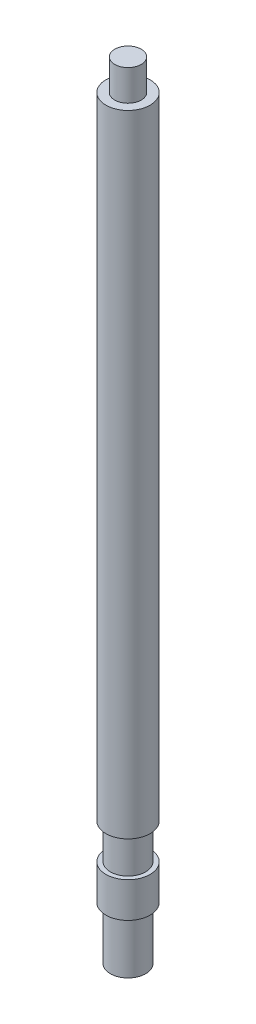
from build123d import *

# Parameters (mm, degrees)
SKETCH1_R           = 5
BOSS_EXTRUDE1_DEPTH = 143
SKETCH2_R           = 4
BOSS_EXTRUDE2_DEPTH = 8
BOSS_EXTRUDE3_START = 8
SKETCH3_R           = 5
BOSS_EXTRUDE3_DEPTH = 8
SKETCH4_R           = 4
BOSS_EXTRUDE4_DEPTH = 12
SKETCH5_R           = 3
BOSS_EXTRUDE5_DEPTH = 7


with BuildPart() as part:
    # Sketch1 → Boss-Extrude1 (new body)
    with BuildSketch(Plane(origin=(0, 0, 0), x_dir=(1, 0, 0), z_dir=(0, 1, 0))):
        Circle(SKETCH1_R)
    extrude(amount=BOSS_EXTRUDE1_DEPTH)

    # Sketch2 → Boss-Extrude2 (add)
    with BuildSketch(Plane.XZ):
        Circle(SKETCH2_R)
    extrude(amount=BOSS_EXTRUDE2_DEPTH)

    # Sketch3 → Boss-Extrude3 (add)
    with BuildSketch(Plane.XZ.offset(8).offset(BOSS_EXTRUDE3_START)):
        Circle(SKETCH3_R)
    extrude(amount=-BOSS_EXTRUDE3_DEPTH)

    # Sketch4 → Boss-Extrude4 (add)
    with BuildSketch(Plane.XZ.offset(16)):
        Circle(SKETCH4_R)
    extrude(amount=BOSS_EXTRUDE4_DEPTH)

    # Sketch5 → Boss-Extrude5 (add)
    with BuildSketch(Plane(origin=(0, 143, 0), x_dir=(1, 0, 0), z_dir=(0, 1, 0))):
        Circle(SKETCH5_R)
    extrude(amount=BOSS_EXTRUDE5_DEPTH)


solid = part.part
